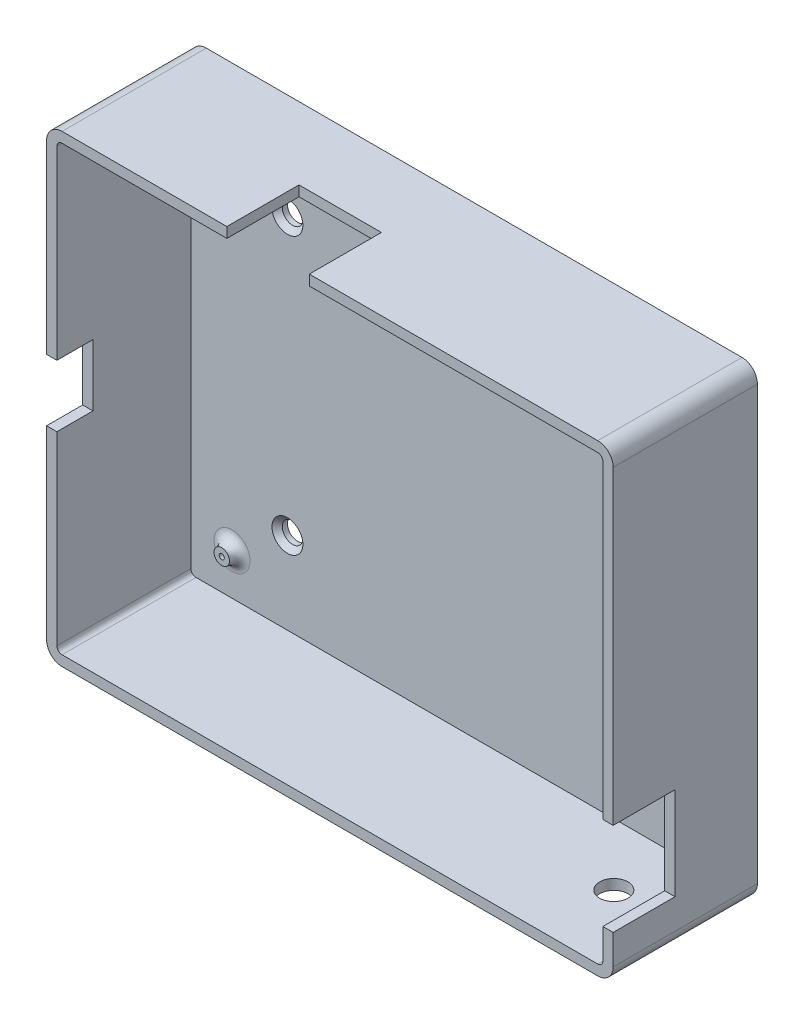
from build123d import *

# Parameters (mm, degrees)
BOSS_EXTRUDE1_DEPTH = 2
BOSS_EXTRUDE2_DEPTH = 26
SKETCH5_R           = 1.5
SKETCH5_R_2         = 0.5
BOSS_EXTRUDE4_DEPTH = 4
FILLET2_R           = 2
SKETCH9_W           = 16
SKETCH9_H           = 14
CUT_EXTRUDE3_DEPTH  = 2.5
SKETCH11_R          = 2.75
CUT_EXTRUDE5_DEPTH  = 2.5
CUT_EXTRUDE6_REACH  = 124.102
SKETCH12_W          = 7
SKETCH12_H          = 12
SKETCH13_W          = 12
SKETCH13_H          = 18
CUT_EXTRUDE7_DEPTH  = 10
SKETCH14_R          = 2
CUT_EXTRUDE8_DEPTH  = 10
CHAMFER1_SIZE       = 1


with BuildPart() as part:
    # Sketch2 → Boss-Extrude1 (new body)
    with BuildSketch(Plane.XY):
        with BuildLine():
            Line((-52, -45), (52, -45))
            ThreePointArc((52, -45), (54.121320344, -44.121320344), (55, -42))
            Line((55, -42), (55, 42))
            ThreePointArc((55, 42), (54.121320344, 44.121320344), (52, 45))
            Line((52, 45), (-52, 45))
            ThreePointArc((-52, 45), (-54.121320344, 44.121320344), (-55, 42))
            Line((-55, 42), (-55, -42))
            ThreePointArc((-55, -42), (-54.121320344, -44.121320344), (-52, -45))
        make_face()
    extrude(amount=BOSS_EXTRUDE1_DEPTH)

    # Sketch3 → Boss-Extrude2 (add)
    with BuildSketch(Plane.XY.offset(2)):
        with BuildLine():
            Line((55, -42), (55, 42))
            ThreePointArc((55, 42), (54.121320344, 44.121320344), (52, 45))
            Line((52, 45), (-52, 45))
            ThreePointArc((-52, 45), (-54.121320344, 44.121320344), (-55, 42))
            Line((-55, 42), (-55, -42))
            ThreePointArc((-55, -42), (-54.121320344, -44.121320344), (-52, -45))
            Line((-52, -45), (52, -45))
            ThreePointArc((52, -45), (54.121320344, -44.121320344), (55, -42))
        make_face()
        with BuildLine():
            Line((52, 43), (-52, 43))
            ThreePointArc((-52, 43), (-52.707106781, 42.707106781), (-53, 42))
            Line((-53, 42), (-53, -42))
            ThreePointArc((-53, -42), (-52.707106781, -42.707106781), (-52, -43))
            Line((-52, -43), (52, -43))
            ThreePointArc((52, -43), (52.707106781, -42.707106781), (53, -42))
            Line((53, -42), (53, 42))
            ThreePointArc((53, 42), (52.707106781, 42.707106781), (52, 43))
        make_face(mode=Mode.SUBTRACT)
    extrude(amount=BOSS_EXTRUDE2_DEPTH)

    # Sketch5 → Boss-Extrude4 (add)
    # profile 1 of 4: a face of its own
    with BuildSketch(Plane(origin=(0, 0, 0), x_dir=(-1, 0, 0), z_dir=(0, 0, -1))):
        with Locations((45, 35)):
            Circle(SKETCH5_R)
        with Locations((45, 35)):
            Circle(SKETCH5_R_2, mode=Mode.SUBTRACT)
    # profile 2 of 4: a face of its own
    with BuildSketch(Plane(origin=(0, 0, 0), x_dir=(-1, 0, 0), z_dir=(0, 0, -1))):
        with Locations((-45, 35)):
            Circle(SKETCH5_R)
        with Locations((-45, 35)):
            Circle(SKETCH5_R_2, mode=Mode.SUBTRACT)
    # profile 3 of 4: a face of its own
    with BuildSketch(Plane(origin=(0, 0, 0), x_dir=(-1, 0, 0), z_dir=(0, 0, -1))):
        with Locations((-45, -35)):
            Circle(SKETCH5_R)
        with Locations((-45, -35)):
            Circle(SKETCH5_R_2, mode=Mode.SUBTRACT)
    # profile 4 of 4: a face of its own
    with BuildSketch(Plane(origin=(0, 0, 0), x_dir=(-1, 0, 0), z_dir=(0, 0, -1))):
        with Locations((45, -35)):
            Circle(SKETCH5_R)
        with Locations((45, -35)):
            Circle(SKETCH5_R_2, mode=Mode.SUBTRACT)
    extrude(amount=-BOSS_EXTRUDE4_DEPTH)

    # Fillet2
    fillet2_edges = [part.edges().sort_by_distance(p)[0] for p in [
        (46.5, 35, 2),
        (46.5, -35, 2),
        (-43.5, -35, 2),
        (-43.5, 35, 2),
    ]]
    fillet(fillet2_edges, radius=FILLET2_R - 0.0001)  # a hair under: the kernel refuses the full size

    # Sketch9 → Cut-Extrude3 (cut)
    with BuildSketch(Plane(origin=(0, 43, 0), x_dir=(-1, 0, 0), z_dir=(0, -1, 0))):
        with Locations((12, -21)):
            Rectangle(SKETCH9_W, SKETCH9_H)
    extrude(amount=-CUT_EXTRUDE3_DEPTH, mode=Mode.SUBTRACT)

    # Sketch11 → Cut-Extrude5 (cut)
    with BuildSketch(Plane(origin=(0, -45, 0), x_dir=(-1, 0, 0), z_dir=(0, -1, 0))):
        with Locations(Location((-41.126488164, -14, 0), (0, 0, 90))):
            Circle(SKETCH11_R)
    extrude(amount=-CUT_EXTRUDE5_DEPTH, mode=Mode.SUBTRACT)

    # Sketch12 → Cut-Extrude6 (cut, up to next)
    with BuildSketch(Plane.ZY.offset(55), mode=Mode.PRIVATE) as cut_extrude6_sk1:
        with Locations((24.5, 0)):
            Rectangle(SKETCH12_W, SKETCH12_H)
    cut_extrude6_tool1 = extrude(cut_extrude6_sk1.sketch, amount=-CUT_EXTRUDE6_REACH, mode=Mode.PRIVATE) & part.part
    add(cut_extrude6_tool1.solids().sort_by_distance((-55, 0, 24.5))[0], mode=Mode.SUBTRACT)

    # Sketch13 → Cut-Extrude7 (cut)
    with BuildSketch(Plane(origin=(55, 0, 0), x_dir=(0, 0, -1), z_dir=(1, 0, 0))):
        with Locations((-22, -27.190217321)):
            Rectangle(SKETCH13_W, SKETCH13_H)
    extrude(amount=-CUT_EXTRUDE7_DEPTH, mode=Mode.SUBTRACT)

    # Sketch14 → Cut-Extrude8 (cut)
    with BuildSketch(Plane.XY.offset(2)):
        with Locations((-34.243884653, -27.074376311)):
            Circle(SKETCH14_R)
        with Locations((34.243884653, 26.574376311)):
            Circle(SKETCH14_R)
        with Locations((34.243884653, -27.074376311)):
            Circle(SKETCH14_R)
        with Locations((-34.243884653, 26.574376311)):
            Circle(SKETCH14_R)
    extrude(amount=-CUT_EXTRUDE8_DEPTH, mode=Mode.SUBTRACT)

    # Chamfer1
    chamfer1_edges = [part.edges().sort_by_distance(p)[0] for p in [
        (-36.243884653, 26.574376311, 2),
        (32.243884653, -27.074376311, 2),
        (32.243884653, 26.574376311, 2),
        (-36.243884653, -27.074376311, 2),
    ]]
    chamfer(chamfer1_edges, length=CHAMFER1_SIZE)


solid = part.part
